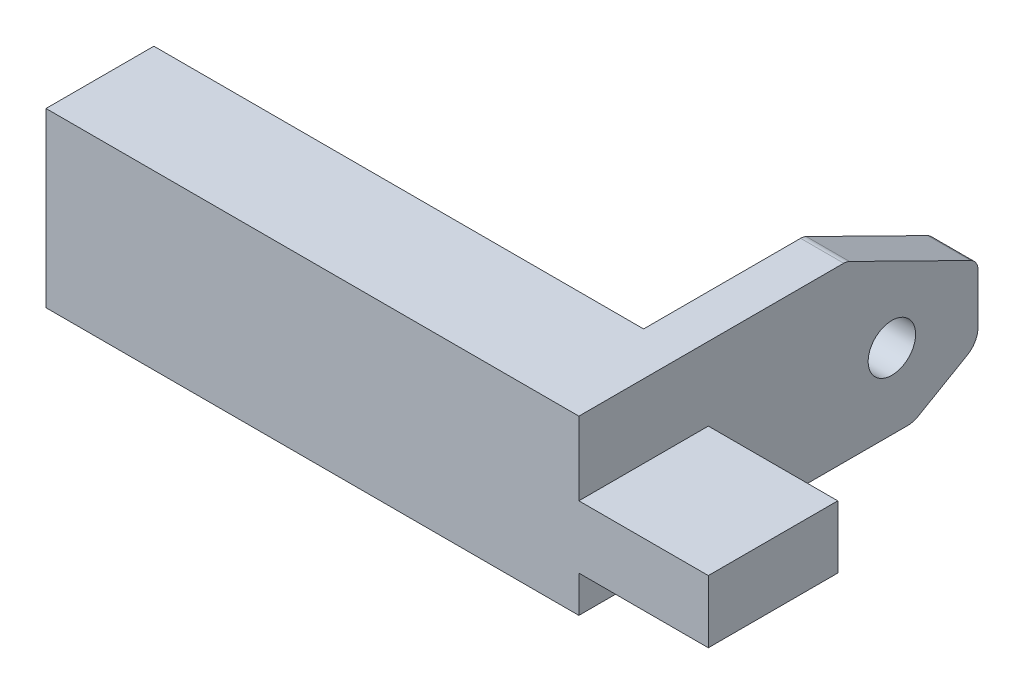
from build123d import *

# Parameters (mm, degrees)
SKETCH1_W           = 92.5
SKETCH1_H           = 40
BOSS_EXTRUDE1_DEPTH = 10
SKETCH5_R           = 5.5
CUT_EXTRUDE1_DEPTH  = 27
SKETCH6_W           = 30
SKETCH6_H           = 6
BOSS_EXTRUDE5_DEPTH = 30
SKETCH7_W           = 30
SKETCH7_H           = 30
BOSS_EXTRUDE6_DEPTH = 8.5
SKETCH4_W           = 25
SKETCH4_H           = 40
SKETCH4_W_2         = 10.4
SKETCH4_H_2         = 25.4
BOSS_EXTRUDE7_DEPTH = 113.5
FILLET1_R           = 3
CHAMFER1_SIZE       = 15
CHAMFER1_SIZE2      = 30.41699103
FILLET3_R           = 3
CHAMFER3_SIZE       = 15
CHAMFER3_SIZE2      = 8.660254038
FILLET7_R           = 5


with BuildPart() as part:
    # Sketch1 → Boss-Extrude1 (new body)
    with BuildSketch(Plane(origin=(0, 0, 0), x_dir=(0, 0, -1), z_dir=(1, 0, 0))):
        with Locations((10.335365854, 0.129573171)):
            Rectangle(SKETCH1_W, SKETCH1_H)
    extrude(amount=BOSS_EXTRUDE1_DEPTH)

    # Sketch5 → Cut-Extrude1 (cut)
    with BuildSketch(Plane.ZY):
        with Locations((-36.625365854, -2.430426829)):
            Circle(SKETCH5_R)
    extrude(amount=-CUT_EXTRUDE1_DEPTH, mode=Mode.SUBTRACT)

    # Sketch6 → Boss-Extrude5 (add)
    with BuildSketch(Plane(origin=(10, 0, 0), x_dir=(0, 0, -1), z_dir=(1, 0, 0))):
        with Locations((-20.914634146, 0.129573171)):
            Rectangle(SKETCH6_W, SKETCH6_H)
    extrude(amount=BOSS_EXTRUDE5_DEPTH)

    # Sketch7 → Boss-Extrude6 (add)
    with BuildSketch(Plane.XZ.offset(2.870426829)):
        with Locations((25, 20.914634146)):
            Rectangle(SKETCH7_W, SKETCH7_H)
    extrude(amount=BOSS_EXTRUDE6_DEPTH)

    # Sketch4 → Boss-Extrude7 (add)
    with BuildSketch(Plane.ZY):
        with Locations((23.414634146, 0.129573171)):
            Rectangle(SKETCH4_W, SKETCH4_H)
        with Locations((23.414634146, 0.129573171)):
            Rectangle(SKETCH4_W_2, SKETCH4_H_2, mode=Mode.SUBTRACT)
    extrude(amount=BOSS_EXTRUDE7_DEPTH)

    # Fillet1
    fillet1_edges = [part.edges().sort_by_distance(p)[0] for p in [
        (-113.5, -12.570426829, 23.414634146),
        (-113.5, 0.129573171, 28.614634146),
        (-113.5, 12.829573171, 23.414634146),
        (-113.5, 0.129573171, 18.214634146),
    ]]
    fillet(fillet1_edges, radius=FILLET1_R)

    # Chamfer1
    chamfer1_edges = [part.edges().sort_by_distance(p)[0] for p in [
        (5, 20.129573171, -56.585365854),
    ]]
    chamfer1_side = [part.faces().sort_by_distance(p)[0] for p in [
        (5, 0.129573171, -56.585365854),
    ]]
    chamfer(chamfer1_edges, length=CHAMFER1_SIZE, length2=CHAMFER1_SIZE2, reference=chamfer1_side[0])

    # Fillet3
    fillet3_edges = [part.edges().sort_by_distance(p)[0] for p in [
        (5, 20.129573171, -26.168374824),
        (5, 5.129573171, -56.585365854),
    ]]
    fillet(fillet3_edges, radius=FILLET3_R)

    # Chamfer3
    chamfer3_edges = [part.edges().sort_by_distance(p)[0] for p in [
        (5, -19.870426829, -56.585365854),
    ]]
    chamfer3_side = [part.faces().sort_by_distance(p)[0] for p in [
        (-41.568936877, -19.870426829, 15.117291954),
    ]]
    chamfer(chamfer3_edges, length=CHAMFER3_SIZE, length2=CHAMFER3_SIZE2, reference=chamfer3_side[0])

    # Fillet7
    fillet7_edges = [part.edges().sort_by_distance(p)[0] for p in [
        (5, -19.870426829, -41.585365854),
        (5, -11.210172791, -56.585365854),
    ]]
    fillet(fillet7_edges, radius=FILLET7_R)


solid = part.part
